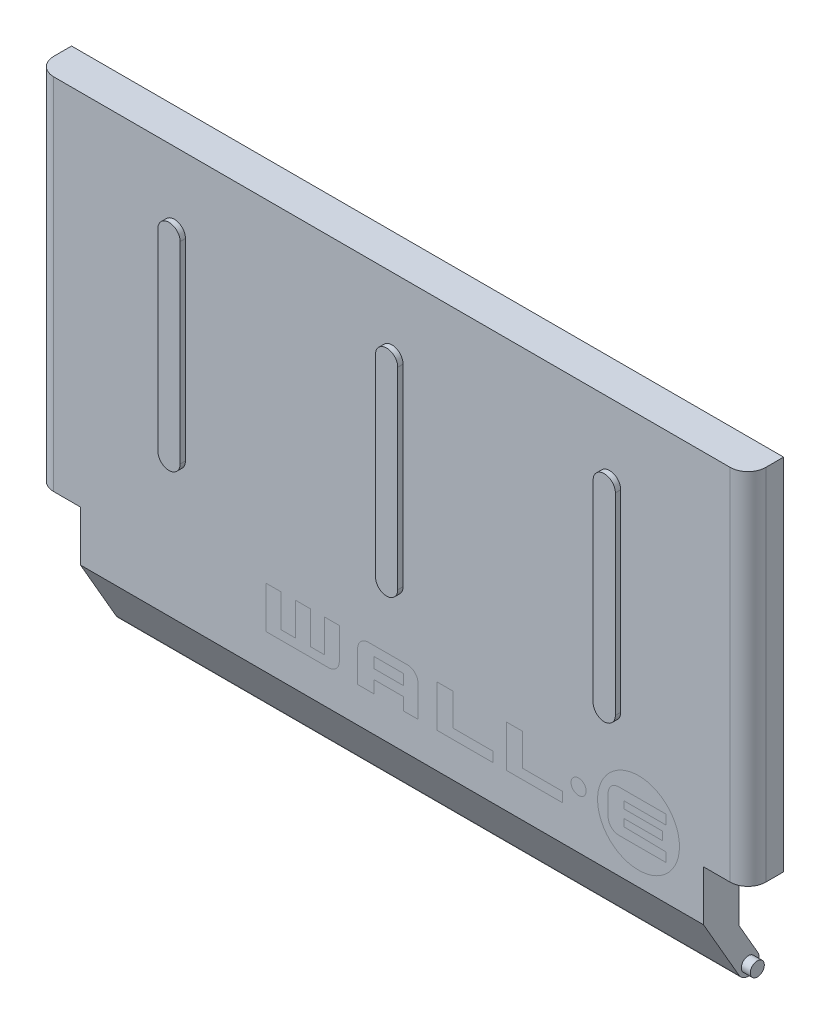
from build123d import *

# Parameters (mm, degrees)
EXTRUDE1_DEPTH               = 5.08
FILLET1_R                    = 2.54
CHAMFER1_SIZE2               = 5.08
CHAMFER1_SIZE                = 8.798818102
EXTRUDE3_DEPTH               = 88.9
EXTRUDE4_DEPTH               = 0.762
SALIENTE_EXTRUIR1_DEPTH      = 1.27
SALIENTE_EXTRUIR1_DEPTH_BACK = 90.17
SKETCH2_R                    = 1.003990475


with BuildPart() as part:
    # Sketch1 → Extrude1 (new body)
    with BuildSketch(Plane.XY):
        Polygon((-49.690313901, -102.787097767), (51.909686099, -102.787097767), (51.909686099, -154.045409896), (45.559686099, -154.045409896), (45.559686099, -170.008151162), (-43.340313901, -170.008151162), (-43.340313901, -154.045409896), (-49.690313901, -154.045409896), align=None)
    extrude(amount=EXTRUDE1_DEPTH)

    # Fillet1
    fillet1_edges = [part.edges().sort_by_distance(p)[0] for p in [
        (51.909686099, -128.416253832, 5.08),
        (-49.690313901, -128.416253832, 5.08),
    ]]
    fillet(fillet1_edges, radius=FILLET1_R)

    # Chamfer1
    chamfer1_edges = [part.edges().sort_by_distance(p)[0] for p in [
        (1.109686099, -170.008151162, 5.08),
    ]]
    chamfer1_side = [part.faces().sort_by_distance(p)[0] for p in [
        (1.109686099, -169.906551162, 5.08),
    ]]
    chamfer(chamfer1_edges, length=CHAMFER1_SIZE - 0.0001, length2=CHAMFER1_SIZE2 - 0.0001, reference=chamfer1_side[0])  # a hair under: the kernel refuses the full size

    # Sketch3 → Extrude3 (add)
    with BuildSketch(Plane(origin=(45.559686099, 0, 0), x_dir=(0, 0, -1), z_dir=(1, 0, 0))):
        with BuildLine():
            Line((-2.656143456, -165.407575745), (0, -170.008151162))
            ThreePointArc((0, -170.008151162), (2.094834297, -170.56946032), (2.656143456, -168.474626023))
            Line((2.656143456, -168.474626023), (0, -163.874050605))
            Line((0, -163.874050605), (-2.656143456, -165.407575745))
        make_face()
    extrude(amount=-EXTRUDE3_DEPTH)

    # Sketch4 → Extrude4 (add)
    with BuildSketch(Plane.XY.offset(5.08)):
        with BuildLine():
            Line((2.697186099, -113.368491021), (2.697186099, -140.858908158))
            ThreePointArc((2.697186099, -140.858908158), (1.109686099, -142.446408158), (-0.477813901, -140.858908158))
            Line((-0.477813901, -140.858908158), (-0.477813901, -113.368491021))
            ThreePointArc((-0.477813901, -113.368491021), (1.109686099, -111.780991021), (2.697186099, -113.368491021))
        make_face()
        with BuildLine():
            Line((-31.531803629, -113.368491021), (-31.531803629, -140.858908158))
            ThreePointArc((-31.531803629, -140.858908158), (-29.944303629, -142.446408158), (-28.356803629, -140.858908158))
            Line((-28.356803629, -140.858908158), (-28.356803629, -113.368491021))
            ThreePointArc((-28.356803629, -113.368491021), (-29.944303629, -111.780991021), (-31.531803629, -113.368491021))
        make_face()
        with BuildLine():
            Line((33.751175827, -113.368491021), (33.751175827, -140.858908158))
            ThreePointArc((33.751175827, -140.858908158), (32.163675827, -142.446408158), (30.576175827, -140.858908158))
            Line((30.576175827, -140.858908158), (30.576175827, -113.368491021))
            ThreePointArc((30.576175827, -113.368491021), (32.163675827, -111.780991021), (33.751175827, -113.368491021))
        make_face()
    extrude(amount=EXTRUDE4_DEPTH)

    # Sketch2 → Saliente-Extruir1 (add, two sides: drawn at the far end of the back side and taken through both)
    with BuildSketch(Plane(origin=(45.559686099, 0, 0), x_dir=(0, 0, -1), z_dir=(1, 0, 0)).offset(-SALIENTE_EXTRUIR1_DEPTH_BACK)):
        with Locations((1.328071728, -169.241388592)):
            Circle(SKETCH2_R)
    extrude(amount=SALIENTE_EXTRUIR1_DEPTH + SALIENTE_EXTRUIR1_DEPTH_BACK)


solid = part.part
